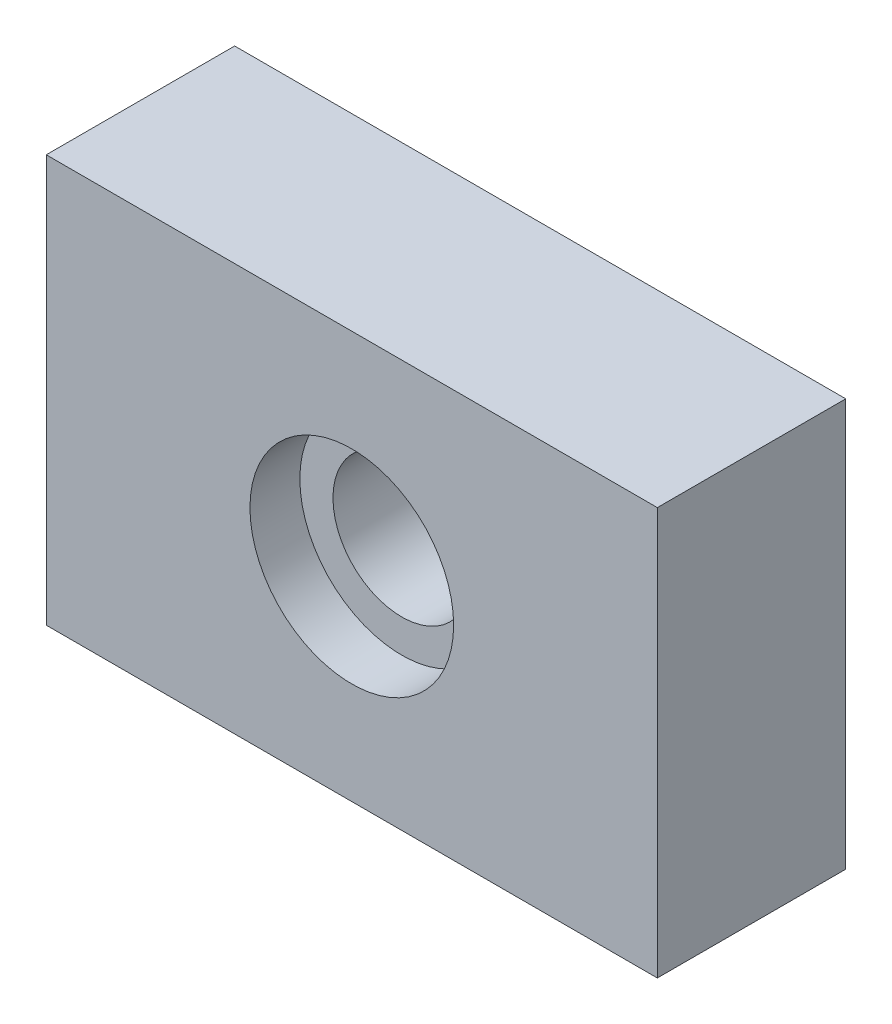
from build123d import *

# Parameters (mm, degrees)
SKETCH1_W           = 152.4
SKETCH1_H           = 101.6
BOSS_EXTRUDE1_DEPTH = 46.99
SKETCH2_R           = 17.145
CUT_EXTRUDE1_DEPTH  = 190.093574983
SKETCH2_2_R         = 25.4
SKETCH2_2_R_2       = 17.145
CUT_EXTRUDE3_DEPTH  = 12.446


with BuildPart() as part:
    # Sketch1 → Boss-Extrude1 (new body)
    with BuildSketch(Plane.XY):
        with Locations((76.2, 50.8)):
            Rectangle(SKETCH1_W, SKETCH1_H)
    extrude(amount=BOSS_EXTRUDE1_DEPTH)

    # Sketch2 → Cut-Extrude1 (cut, through all)
    with BuildSketch(Plane(origin=(0, 0, 0), x_dir=(-1, 0, 0), z_dir=(0, 0, -1))):
        with Locations((-76.2, 50.8)):
            Circle(SKETCH2_R)
    extrude(amount=-CUT_EXTRUDE1_DEPTH, mode=Mode.SUBTRACT)

    # Sketch2<2> → Cut-Extrude3 (cut)
    with BuildSketch(Plane(origin=(0, 0, 0), x_dir=(-1, 0, 0), z_dir=(0, 0, -1))):
        with Locations((-76.2, 50.8)):
            Circle(SKETCH2_2_R)
        with Locations((-76.2, 50.8)):
            Circle(SKETCH2_2_R_2, mode=Mode.SUBTRACT)
    cut_extrude3 = extrude(amount=-CUT_EXTRUDE3_DEPTH, mode=Mode.SUBTRACT)

    # Mirror2: Cut-Extrude3 across plane
    add(cut_extrude3.mirror(Plane(origin=(0, 0, 23.495), x_dir=(1, 0, 0), z_dir=(0, 0, -1))), mode=Mode.SUBTRACT)


solid = part.part
